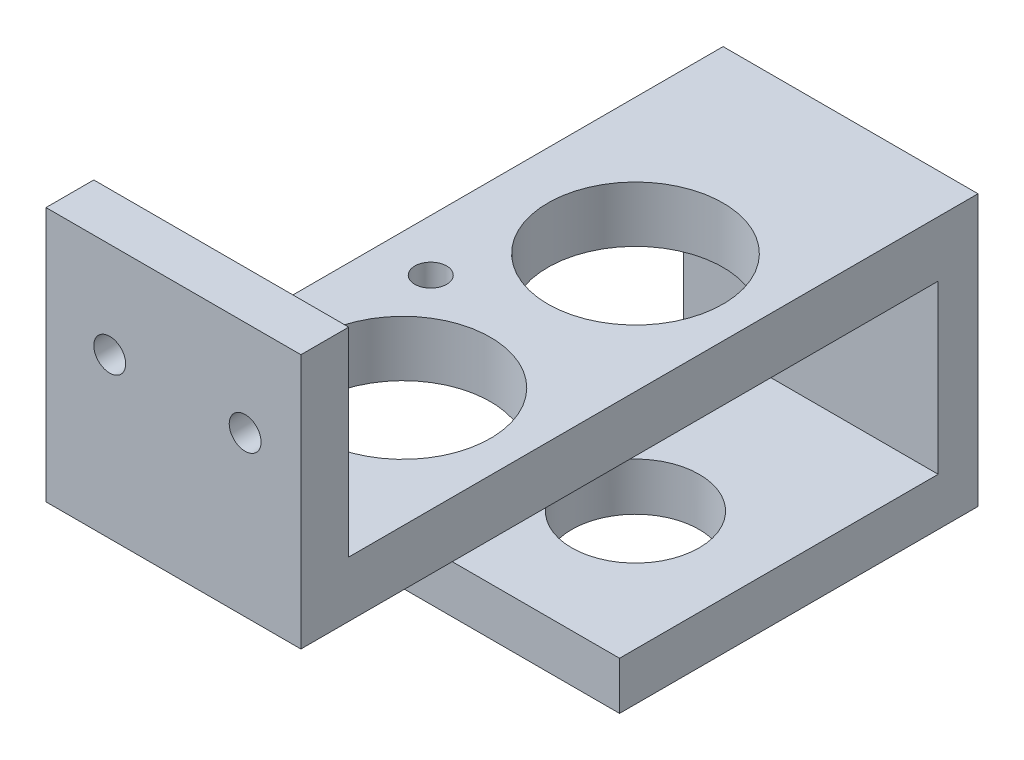
from build123d import *

# Parameters (mm, degrees)
SKETCH1_W           = 32
SKETCH1_H           = 85
BOSS_EXTRUDE1_DEPTH = 7
SKETCH2_R           = 11
CUT_EXTRUDE1_DEPTH  = 100
SKETCH3_R           = 11
CUT_EXTRUDE2_DEPTH  = 7
SKETCH4_W           = 32
SKETCH4_H           = 6
BOSS_EXTRUDE3_DEPTH = 25
SKETCH5_R           = 2
CUT_EXTRUDE3_DEPTH  = 14
SKETCH6_R           = 2
CUT_EXTRUDE4_DEPTH  = 14
SKETCH10_W          = 32
SKETCH10_H          = 5
BOSS_EXTRUDE4_DEPTH = 27
SKETCH11_W          = 32
SKETCH11_H          = 6
BOSS_EXTRUDE5_DEPTH = 40
SKETCH9_R           = 8
CUT_EXTRUDE5_DEPTH  = 40


with BuildPart() as part:
    # Sketch1 → Boss-Extrude1 (new body)
    with BuildSketch(Plane(origin=(0, 0, 0), x_dir=(1, 0, 0), z_dir=(0, 1, 0))):
        with Locations((-34.16194332, -13.734817814)):
            Rectangle(SKETCH1_W, SKETCH1_H)
    extrude(amount=BOSS_EXTRUDE1_DEPTH)

    # Sketch2 → Cut-Extrude1 (cut)
    with BuildSketch(Plane(origin=(0, 7, 0), x_dir=(1, 0, 0), z_dir=(0, 1, 0))):
        with Locations((-33.16194332, 0.765182186)):
            Circle(SKETCH2_R)
    extrude(amount=-CUT_EXTRUDE1_DEPTH, mode=Mode.SUBTRACT)

    # Sketch3 → Cut-Extrude2 (cut)
    with BuildSketch(Plane(origin=(0, 7, 0), x_dir=(1, 0, 0), z_dir=(0, 1, 0))):
        with Locations((-33.16194332, -28.434817814)):
            Circle(SKETCH3_R)
    extrude(amount=-CUT_EXTRUDE2_DEPTH, mode=Mode.SUBTRACT)

    # Sketch4 → Boss-Extrude3 (add)
    with BuildSketch(Plane(origin=(0, 7, 0), x_dir=(1, 0, 0), z_dir=(0, 1, 0))):
        with Locations((-34.16194332, -53.234817814)):
            Rectangle(SKETCH4_W, SKETCH4_H)
    extrude(amount=BOSS_EXTRUDE3_DEPTH)

    # Sketch5 → Cut-Extrude3 (cut)
    with BuildSketch(Plane(origin=(0, 0, 50.234817814), x_dir=(-1, 0, 0), z_dir=(0, 0, -1))):
        with Locations((42.16194332, 20)):
            Circle(SKETCH5_R)
        with Locations((25.16194332, 20)):
            Circle(SKETCH5_R)
    extrude(amount=-CUT_EXTRUDE3_DEPTH, mode=Mode.SUBTRACT)

    # Sketch6 → Cut-Extrude4 (cut)
    with BuildSketch(Plane(origin=(0, 7, 0), x_dir=(1, 0, 0), z_dir=(0, 1, 0))):
        with Locations((-43.66194332, -14.434817814)):
            Circle(SKETCH6_R)
        with Locations((-43.66194332, -42.434817814)):
            Circle(SKETCH6_R)
    extrude(amount=-CUT_EXTRUDE4_DEPTH, mode=Mode.SUBTRACT)

    # Sketch10 → Boss-Extrude4 (add)
    with BuildSketch(Plane.XZ):
        with Locations((-34.16194332, -26.265182186)):
            Rectangle(SKETCH10_W, SKETCH10_H)
    extrude(amount=BOSS_EXTRUDE4_DEPTH)

    # Sketch11 → Boss-Extrude5 (add)
    with BuildSketch(Plane.XY.offset(-23.765182186)):
        with Locations((-34.16194332, -24)):
            Rectangle(SKETCH11_W, SKETCH11_H)
    extrude(amount=BOSS_EXTRUDE5_DEPTH)

    # Sketch9 → Cut-Extrude5 (cut)
    with BuildSketch(Plane(origin=(0, 7, 0), x_dir=(1, 0, 0), z_dir=(0, 1, 0))):
        with Locations((-33.16194332, 0.765182186)):
            Circle(SKETCH9_R)
    extrude(amount=-CUT_EXTRUDE5_DEPTH, mode=Mode.SUBTRACT)


solid = part.part
